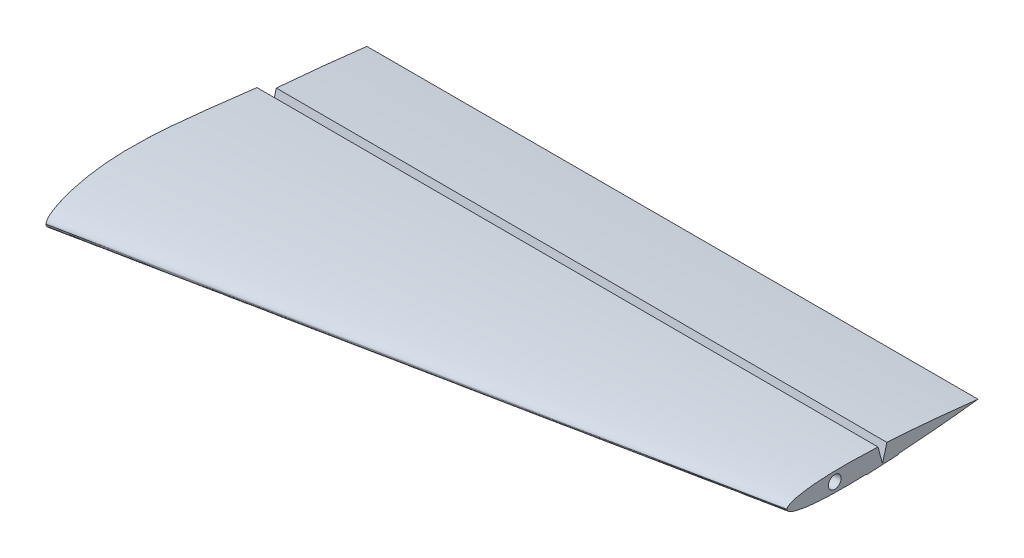
from build123d import *

# Parameters (mm, degrees)
CUT_EXTRUDE3_DEPTH      = 519.712361423
CUT_EXTRUDE3_DEPTH_BACK = 519.712361423
SKETCH14_R              = 5
CUT_EXTRUDE1_DEPTH      = 560.156743602
CUT_EXTRUDE1_DEPTH_BACK = 560.156743602
SKETCH10_W              = 20
SKETCH10_H              = 79.07223766
SKETCH11_R              = 15
CUT_EXTRUDE2_DEPTH      = 560.156743602
CUT_EXTRUDE4_DEPTH      = 5.2
CUT_EXTRUDE4_DEPTH_BACK = 558.820012862
SKETCH16_W              = 44
SKETCH16_H              = 44


with BuildPart() as part:
    # Sketch7 → Loft2 section 0
    with BuildSketch(Plane(origin=(500, 0, 0), x_dir=(0, 0, -1), z_dir=(1, 0, 0))):
        with BuildLine():
            add(Edge.make_bspline(
                [(-150, 0), (-149.999937168, 0.117458016), (-149.976690854, 0.362354041), (-149.855735538, 0.757950568), (-149.476892342, 1.343884103), (-148.865894277, 1.905141517), (-147.945661581, 2.509663886), (-146.476265497, 3.220015573), (-144.04432364, 4.090753893), (-139.704028605, 5.166773097), (-132.776680638, 6.26979221), (-123.484627866, 7.090651632), (-112.495358508, 7.519503098), (-100.569404353, 7.537422113), (-88.776783522, 7.262493565), (-76.789856001, 6.732528635), (-65.139317368, 6.064399479), (-52.963497284, 5.188719038), (-41.674684407, 4.298475849), (-28.949499412, 3.123024292), (-18.626485717, 2.12842443), (-7.922257682, 0.935284249), (-2.680333682, 0.324655417), (0, 0)],
                knots=[0, 0, 0, 0, 0, 0.0027914, 0.005882719, 0.009734657, 0.016522403, 0.022438151, 0.032158027, 0.04863424, 0.078248652, 0.129036717, 0.199997011, 0.270957307, 0.341917602, 0.412877898, 0.483838194, 0.554798491, 0.625758787, 0.696719083, 0.767679379, 0.838639675, 0.909599973, 0.909599973, 0.909599973, 0.909599973, 0.909599973], degree=4))
            add(Edge.make_bspline(
                [(-150, 0), (-149.999937169, -0.117458016), (-149.976690854, -0.362354041), (-149.855735538, -0.757950568), (-149.476892342, -1.343884103), (-148.865894277, -1.905141517), (-147.945661581, -2.509663886), (-146.476265497, -3.220015573), (-144.04432364, -4.090753893), (-139.704028605, -5.166773097), (-132.776680638, -6.26979221), (-123.484627866, -7.090651632), (-112.495358508, -7.519503098), (-100.569404353, -7.537422113), (-88.776783522, -7.262493565), (-76.789856001, -6.732528635), (-65.139317368, -6.064399479), (-52.963497285, -5.188719038), (-41.674684407, -4.298475849), (-28.949499412, -3.123024292), (-18.626485717, -2.12842443), (-7.922257682, -0.935284249), (-2.680333682, -0.324655417), (0, 0)],
                knots=[0, 0, 0, 0, 0, 0.0027914, 0.005882719, 0.009734657, 0.016522403, 0.022438151, 0.032158027, 0.04863424, 0.078248652, 0.129036717, 0.199997011, 0.270957307, 0.341917602, 0.412877898, 0.483838194, 0.554798491, 0.625758787, 0.696719083, 0.767679379, 0.838639675, 0.909599973, 0.909599973, 0.909599973, 0.909599973, 0.909599973], degree=4))
        make_face()
    # Sketch4 → Loft2 section 1
    with BuildSketch(Plane(origin=(0, 0, 0), x_dir=(0, 0, -1), z_dir=(1, 0, 0))):
        with BuildLine():
            add(Edge.make_bspline(
                [(-250, 0), (-249.999895281, 0.195763361), (-249.961151424, 0.603923402), (-249.75955923, 1.263250946), (-249.128153903, 2.239806839), (-248.109823795, 3.175235862), (-246.576102635, 4.182773144), (-244.127109162, 5.366692622), (-240.073872734, 6.817923154), (-232.840047676, 8.611288496), (-221.29446773, 10.449653683), (-205.80771311, 11.81775272), (-187.49226418, 12.532505163), (-167.615673922, 12.562370188), (-147.96130587, 12.104155942), (-127.983093335, 11.220881059), (-108.565528946, 10.107332464), (-88.272495474, 8.647865064), (-69.457807346, 7.164126414), (-48.249165687, 5.205040487), (-31.044142862, 3.54737405), (-13.203762803, 1.558807082), (-4.467222803, 0.541092362), (0, 0)],
                knots=[0, 0, 0, 0, 0, 0.0027914, 0.005882719, 0.009734657, 0.016522403, 0.022438151, 0.032158027, 0.04863424, 0.078248652, 0.129036717, 0.199997011, 0.270957307, 0.341917602, 0.412877898, 0.483838194, 0.554798491, 0.625758787, 0.696719083, 0.767679379, 0.838639675, 0.909599973, 0.909599973, 0.909599973, 0.909599973, 0.909599973], degree=4))
            add(Edge.make_bspline(
                [(-250, 0), (-249.999895281, -0.195763361), (-249.961151424, -0.603923402), (-249.75955923, -1.263250946), (-249.128153903, -2.239806839), (-248.109823795, -3.175235862), (-246.576102635, -4.182773144), (-244.127109162, -5.366692622), (-240.073872734, -6.817923154), (-232.840047676, -8.611288496), (-221.29446773, -10.449653683), (-205.80771311, -11.81775272), (-187.49226418, -12.532505163), (-167.615673922, -12.562370188), (-147.96130587, -12.104155942), (-127.983093335, -11.220881059), (-108.565528946, -10.107332464), (-88.272495474, -8.647865064), (-69.457807346, -7.164126414), (-48.249165687, -5.205040487), (-31.044142862, -3.54737405), (-13.203762803, -1.558807082), (-4.467222803, -0.541092362), (0, 0)],
                knots=[0, 0, 0, 0, 0, 0.0027914, 0.005882719, 0.009734657, 0.016522403, 0.022438151, 0.032158027, 0.04863424, 0.078248652, 0.129036717, 0.199997011, 0.270957307, 0.341917602, 0.412877898, 0.483838194, 0.554798491, 0.625758787, 0.696719083, 0.767679379, 0.838639675, 0.909599973, 0.909599973, 0.909599973, 0.909599973, 0.909599973], degree=4))
        make_face()
    loft()

    # Sketch9 → Cut-Loft1 section 0
    with BuildSketch(Plane(origin=(500, 0, 0), x_dir=(0, 0, -1), z_dir=(1, 0, 0))):
        with BuildLine():
            Line((-75, -6.383696601), (-79.092377838, 8.889265416))
            Line((-79.092377838, 8.889265416), (-70.907622162, 8.889265416))
            Line((-70.907622162, 8.889265416), (-75, -6.383696601))
        make_face()
    # Sketch8 → Cut-Loft1 section 1
    with BuildSketch(Plane.ZY):
        with BuildLine():
            Line((75, -7.292990882), (70.17329306, 10.72052465))
            Line((70.17329306, 10.72052465), (79.82670694, 10.72052465))
            Line((79.82670694, 10.72052465), (75, -7.292990882))
        make_face()
    loft(mode=Mode.SUBTRACT)

    # Sketch14 → Cut-Extrude3 (cut, two sides: drawn at the far end of the back side and taken through both)
    with BuildSketch(Plane(origin=(500, 0, 112.5), x_dir=(0.14834045293057432, 0, 0.9889363528682482), z_dir=(-0.9889363528682482, 0, 0.14834045293057432)).offset(-CUT_EXTRUDE3_DEPTH_BACK)):
        Circle(SKETCH14_R)
    extrude(amount=CUT_EXTRUDE3_DEPTH + CUT_EXTRUDE3_DEPTH_BACK, mode=Mode.SUBTRACT)

    # Sketch10 → Cut-Extrude1 (cut, two sides: drawn at the far end of the back side and taken through both)
    with BuildSketch(Plane(origin=(0, 0, 0), x_dir=(1, 0, 0), z_dir=(0, 1, 0)).offset(-CUT_EXTRUDE1_DEPTH_BACK)):
        with Locations((10, -39.53611883)):
            Rectangle(SKETCH10_W, SKETCH10_H)
    extrude(amount=CUT_EXTRUDE1_DEPTH + CUT_EXTRUDE1_DEPTH_BACK, mode=Mode.SUBTRACT)

    # Sketch11 → Cut-Extrude2 (cut, through all)
    with BuildSketch(Plane.XY):
        Circle(SKETCH11_R)
    extrude(amount=CUT_EXTRUDE2_DEPTH, mode=Mode.SUBTRACT)

    # Sketch16 → Cut-Extrude4 (cut, two sides: drawn at the far end of the back side and taken through both)
    with BuildSketch(Plane(origin=(0, 0, 0), x_dir=(1, 0, 0), z_dir=(0, 1, 0)).offset(-CUT_EXTRUDE4_DEPTH_BACK)):
        with Locations((52, -117)):
            Rectangle(SKETCH16_W, SKETCH16_H)
    extrude(amount=CUT_EXTRUDE4_DEPTH + CUT_EXTRUDE4_DEPTH_BACK, mode=Mode.SUBTRACT)

    # Sketch18 → Loft3 section 0
    with BuildSketch(Plane.ZY.offset(-20)):
        with BuildLine():
            Line((62.52061886, -6.486670562), (87.52061886, -8.589768124))
            Line((87.52061886, -8.589768124), (87.478556909, -9.089768124))
            Line((87.478556909, -9.089768124), (62.478556909, -6.986670562))
            Line((62.478556909, -6.986670562), (62.52061886, -6.486670562))
        make_face()
    # Sketch17 → Loft3 section 1
    with BuildSketch(Plane(origin=(500, 0, 0), x_dir=(0, 0, -1), z_dir=(1, 0, 0))):
        with BuildLine():
            Line((-87.476150939, -7.165814199), (-62.476150939, -5.852801761))
            Line((-62.476150939, -5.852801761), (-62.449926834, -6.352113583))
            Line((-62.449926834, -6.352113583), (-87.449926834, -7.665126021))
            Line((-87.449926834, -7.665126021), (-87.476150939, -7.165814199))
        make_face()
    loft()


solid = part.part
